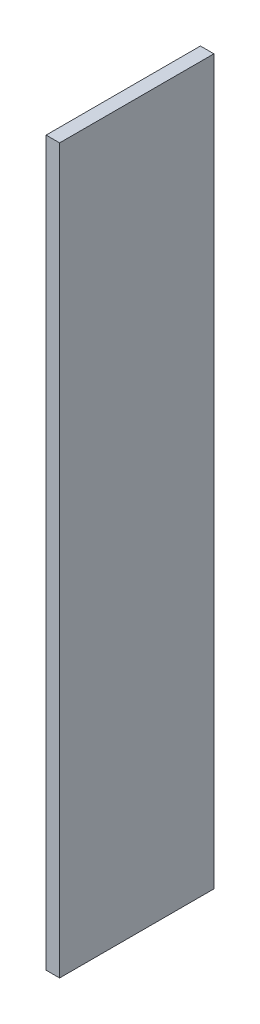
from build123d import *

# Parameters (mm, degrees)
SKETCH1_W           = 16
SKETCH1_H           = 75
BOSS_EXTRUDE4_DEPTH = 1.4


with BuildPart() as part:
    # Sketch1 → Boss-Extrude4 (new body)
    with BuildSketch(Plane(origin=(0, 0, 0), x_dir=(0, 0, -1), z_dir=(1, 0, 0))):
        Rectangle(SKETCH1_W, SKETCH1_H)
    extrude(amount=BOSS_EXTRUDE4_DEPTH)


solid = part.part
